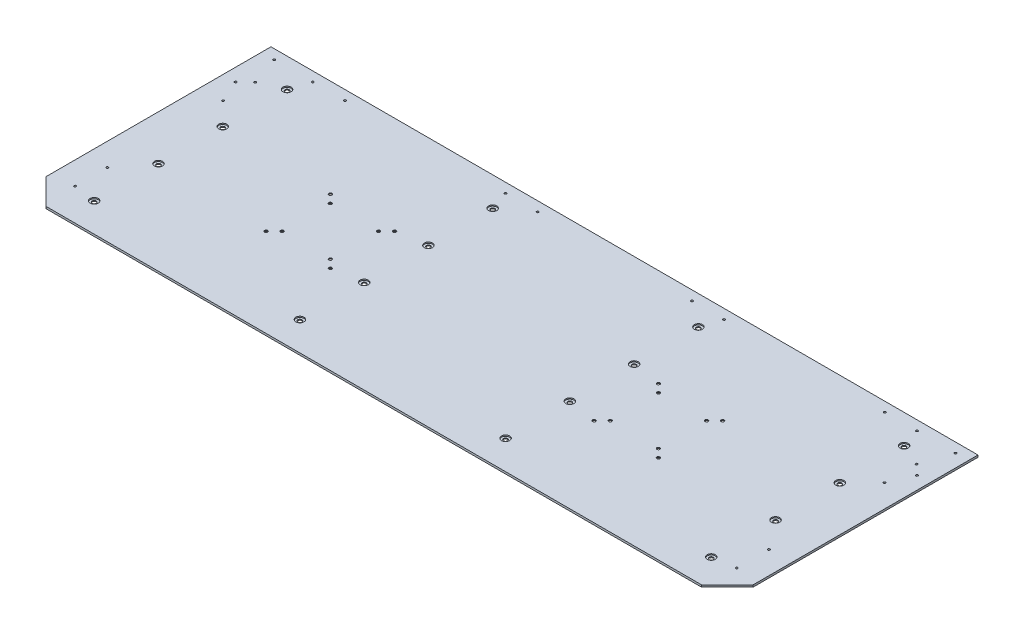
from build123d import *

# Parameters (mm, degrees)
SKETCH1_W                  = 1100
SKETCH1_H                  = 390
PLATE_DEPTH                = 3.175
MONITOR_HOLES_AT_2_COUNT   = 2
MONITOR_HOLES_AT_2_PITCH   = 106.066017178
MONITOR_HOLES_AT_3_COUNT   = 2
MONITOR_HOLES_AT_3_PITCH   = 75
MONITOR_HOLES_AT_4_COUNT   = 2
MONITOR_HOLES_AT_4_PITCH   = 75
MONITOR_HOLES_AT_5_COUNT   = 2
MONITOR_HOLES_AT_5_PITCH   = 17.67766953
MONITOR_HOLES_AT_6_COUNT   = 2
MONITOR_HOLES_AT_6_PITCH   = 123.743686708
MONITOR_HOLES_AT_7_COUNT   = 2
MONITOR_HOLES_AT_7_PITCH   = 88.388347648
MONITOR_HOLES_AT_8_COUNT   = 2
MONITOR_HOLES_AT_8_PITCH   = 88.388347648
MONITOR_HOLES_AT_9_COUNT   = 2
MONITOR_HOLES_AT_9_PITCH   = 510.4
MONITOR_HOLES_AT_10_COUNT  = 2
MONITOR_HOLES_AT_10_PITCH  = 435.4
MONITOR_HOLES_AT_11_COUNT  = 2
MONITOR_HOLES_AT_11_PITCH  = 515.88095526
MONITOR_HOLES_AT_12_COUNT  = 2
MONITOR_HOLES_AT_12_PITCH  = 441.81235836
MONITOR_HOLES_AT_13_COUNT  = 2
MONITOR_HOLES_AT_13_PITCH  = 530.170406568
MONITOR_HOLES_AT_14_COUNT  = 2
MONITOR_HOLES_AT_14_PITCH  = 431.857221776
MONITOR_HOLES_AT_15_COUNT  = 2
MONITOR_HOLES_AT_15_PITCH  = 523.049385814
MONITOR_HOLES_AT_16_COUNT  = 2
MONITOR_HOLES_AT_16_PITCH  = 423.084696013
STRUT_HOLES_D              = 3.3
GLARE_PROTECTOR_HOLES_D    = 3.3
CHAMFER1_SIZE              = 40
CARRIAGE_HOLES_D           = 6.35
CARRIAGE_HOLES_CBORE_D     = 12.7
CARRIAGE_HOLES_CBORE_DEPTH = 1.7875


with BuildPart() as part:
    # Sketch1 → Plate (new body)
    with BuildSketch(Plane(origin=(0, 0, 0), x_dir=(1, 0, 0), z_dir=(0, 1, 0))):
        Rectangle(SKETCH1_W, SKETCH1_H)
    extrude(amount=PLATE_DEPTH)

    # Sketch7 → Monitor Holes (revolve, cut)
    with BuildSketch(Plane(origin=(217.7, 0, -30.1), x_dir=(0, 0, -1), z_dir=(1, 0, 0))):
        Polygon((0, 0), (0, 3.175), (2.4, 3.175), (2.4, 2.08), (4.48, 0), align=None)
    monitor_holes = revolve(axis=Axis((217.7, -6.35, -30.1), (0, 1, 0)), mode=Mode.SUBTRACT)

    # Monitor Holes at 2: Monitor Holes ×2
    with Locations(*[Vector(0.7071067811865477, 0, 0.7071067811865474) * (i * MONITOR_HOLES_AT_2_PITCH) for i in range(1, MONITOR_HOLES_AT_2_COUNT)]):
        add(monitor_holes, mode=Mode.SUBTRACT)

    # Monitor Holes at 3: Monitor Holes ×2
    with Locations(*[(i * MONITOR_HOLES_AT_3_PITCH, 0, 0) for i in range(1, MONITOR_HOLES_AT_3_COUNT)]):
        add(monitor_holes, mode=Mode.SUBTRACT)

    # Monitor Holes at 4: Monitor Holes ×2
    with Locations(*[(0, 0, i * MONITOR_HOLES_AT_4_PITCH) for i in range(1, MONITOR_HOLES_AT_4_COUNT)]):
        add(monitor_holes, mode=Mode.SUBTRACT)

    # Monitor Holes at 5: Monitor Holes ×2
    with Locations(*[Vector(-0.7071067811865468, 0, -0.7071067811865483) * (i * MONITOR_HOLES_AT_5_PITCH) for i in range(1, MONITOR_HOLES_AT_5_COUNT)]):
        add(monitor_holes, mode=Mode.SUBTRACT)

    # Monitor Holes at 6: Monitor Holes ×2
    with Locations(*[Vector(0.7071067811865478, 0, 0.7071067811865474) * (i * MONITOR_HOLES_AT_6_PITCH) for i in range(1, MONITOR_HOLES_AT_6_COUNT)]):
        add(monitor_holes, mode=Mode.SUBTRACT)

    # Monitor Holes at 7: Monitor Holes ×2
    with Locations(*[Vector(0.9899494936611666, 0, -0.1414213562373094) * (i * MONITOR_HOLES_AT_7_PITCH) for i in range(1, MONITOR_HOLES_AT_7_COUNT)]):
        add(monitor_holes, mode=Mode.SUBTRACT)

    # Monitor Holes at 8: Monitor Holes ×2
    with Locations(*[Vector(-0.14142135623730914, 0, 0.9899494936611667) * (i * MONITOR_HOLES_AT_8_PITCH) for i in range(1, MONITOR_HOLES_AT_8_COUNT)]):
        add(monitor_holes, mode=Mode.SUBTRACT)

    # Monitor Holes at 9: Monitor Holes ×2
    with Locations(*[(-i * MONITOR_HOLES_AT_9_PITCH, 0, 0) for i in range(1, MONITOR_HOLES_AT_9_COUNT)]):
        add(monitor_holes, mode=Mode.SUBTRACT)

    # Monitor Holes at 10: Monitor Holes ×2
    with Locations(*[(-i * MONITOR_HOLES_AT_10_PITCH, 0, 0) for i in range(1, MONITOR_HOLES_AT_10_COUNT)]):
        add(monitor_holes, mode=Mode.SUBTRACT)

    # Monitor Holes at 11: Monitor Holes ×2
    with Locations(*[Vector(-0.989375542546892, 0, 0.14538237792127132) * (i * MONITOR_HOLES_AT_11_PITCH) for i in range(1, MONITOR_HOLES_AT_11_COUNT)]):
        add(monitor_holes, mode=Mode.SUBTRACT)

    # Monitor Holes at 12: Monitor Holes ×2
    with Locations(*[Vector(-0.9854862403934994, 0, 0.16975532390792936) * (i * MONITOR_HOLES_AT_12_PITCH) for i in range(1, MONITOR_HOLES_AT_12_COUNT)]):
        add(monitor_holes, mode=Mode.SUBTRACT)

    # Monitor Holes at 13: Monitor Holes ×2
    with Locations(*[Vector(-0.9862866608971649, 0, 0.16504127525052958) * (i * MONITOR_HOLES_AT_13_PITCH) for i in range(1, MONITOR_HOLES_AT_13_COUNT)]):
        add(monitor_holes, mode=Mode.SUBTRACT)

    # Monitor Holes at 14: Monitor Holes ×2
    with Locations(*[Vector(-0.9792588352718359, 0, 0.2026132610221935) * (i * MONITOR_HOLES_AT_14_PITCH) for i in range(1, MONITOR_HOLES_AT_14_COUNT)]):
        add(monitor_holes, mode=Mode.SUBTRACT)

    # Monitor Holes at 15: Monitor Holes ×2
    with Locations(*[Vector(-0.9997143944383325, 0, -0.023898316944882675) * (i * MONITOR_HOLES_AT_15_PITCH) for i in range(1, MONITOR_HOLES_AT_15_COUNT)]):
        add(monitor_holes, mode=Mode.SUBTRACT)

    # Monitor Holes at 16: Monitor Holes ×2
    with Locations(*[Vector(-0.9995634538090055, 0, -0.029544911734718758) * (i * MONITOR_HOLES_AT_16_PITCH) for i in range(1, MONITOR_HOLES_AT_16_COUNT)]):
        add(monitor_holes, mode=Mode.SUBTRACT)

    # Strut Holes (through all)
    with Locations(Plane(origin=(0, 3.175, 0), x_dir=(1, 0, 0), z_dir=(0, 1, 0))):
        with Locations((-530, 180), (-530, 120), (530, 180), (530, 120)):
            Hole(STRUT_HOLES_D / 2)

    # Glare Protector Holes (through all)
    with Locations(Plane(origin=(0, 3.175, 0), x_dir=(1, 0, 0), z_dir=(0, 1, 0))):
        with Locations((-514.6, 135), (-514.6, 85), (-514.6, -145), (-514.6, -95), (-470, 180), (-420, 180), (-170, 180), (-120, 180), (420, 180), (470, 180), (120, 180), (170, 180), (514.6, 135), (514.6, 85), (514.6, -145), (514.6, -95)):
            Hole(GLARE_PROTECTOR_HOLES_D / 2)

    # Chamfer1
    chamfer1_edges = [part.edges().sort_by_distance(p)[0] for p in [
        (550, 1.5875, 195),
        (-550, 1.5875, 195),
    ]]
    chamfer(chamfer1_edges, length=CHAMFER1_SIZE)

    # Carriage Holes (through all)
    with Locations(Plane(origin=(0, 3.175, 0), x_dir=(1, 0, 0), z_dir=(0, 1, 0))):
        with Locations((160, -150), (480, -150), (160, -50), (480, -50), (160, 50), (480, 50), (160, 150), (480, 150)):
            carriage_holes = CounterBoreHole(CARRIAGE_HOLES_D / 2, CARRIAGE_HOLES_CBORE_D / 2, CARRIAGE_HOLES_CBORE_DEPTH)

    # Mirror1: Carriage Holes across plane
    add(carriage_holes.mirror(Plane(origin=(0, 0, 0), x_dir=(0, 0, 1), z_dir=(1, 0, 0))), mode=Mode.SUBTRACT)


solid = part.part
